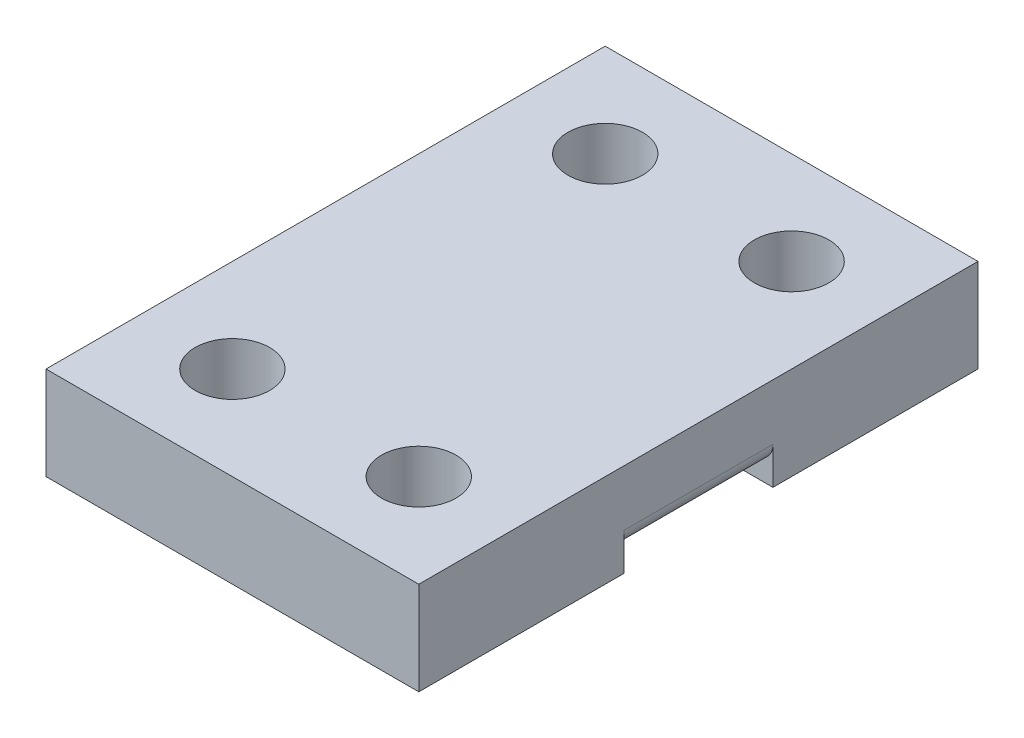
from build123d import *

# Parameters (mm, degrees)
SKETCH_1_W               = 20
SKETCH_1_H               = 30
SKETCH_1_R               = 2
EXTRUDE_1_DEPTH          = 5
CUT_EXTRUDE_6_DEPTH      = 4
CUT_EXTRUDE_6_DEPTH_BACK = 4
CUT_EXTRUDE_6_START      = -15
FILLET_1_R               = 1


with BuildPart() as part:
    # 스케치1 → 보스-돌출1 (new body)
    with BuildSketch(Plane(origin=(0, 0, 0), x_dir=(1, 0, 0), z_dir=(0, 1, 0))):
        with Locations((0, 15)):
            Rectangle(SKETCH_1_W, SKETCH_1_H)
        with Locations(Location((5, 25, 0), (0, 0, 270))):
            Circle(SKETCH_1_R, mode=Mode.SUBTRACT)
        with Locations(Location((-5, 25, 0), (0, 0, 90))):
            Circle(SKETCH_1_R, mode=Mode.SUBTRACT)
        with Locations(Location((5, 5, 0), (0, 0, 270))):
            Circle(SKETCH_1_R, mode=Mode.SUBTRACT)
        with Locations(Location((-5, 5, 0), (0, 0, 90))):
            Circle(SKETCH_1_R, mode=Mode.SUBTRACT)
    extrude(amount=EXTRUDE_1_DEPTH)

    # 스케치3 → 컷-돌출6 (cut, two sides: drawn at the far end of the back side and taken through both)
    with BuildSketch(Plane(origin=(0, 0, -30), x_dir=(-1, 0, 0), z_dir=(0, 0, -1)).offset(CUT_EXTRUDE_6_START - CUT_EXTRUDE_6_DEPTH_BACK)):
        Polygon((0, 0), (-1, 1), (-2, 0), align=None)
        Polygon((1, 1), (0, 0), (2, 0), align=None)
        Polygon((-2, 0), (-3, 1), (-4, 0), align=None)
        Polygon((3, 1), (2, 0), (4, 0), align=None)
        Polygon((-4, 0), (-5, 1), (-6, 0), align=None)
        Polygon((5, 1), (4, 0), (6, 0), align=None)
        Polygon((-6, 0), (-7, 1), (-8, 0), align=None)
        Polygon((7, 1), (6, 0), (8, 0), align=None)
        Polygon((-8, 0), (-9, 1), (-10, 1), (-10, 0), align=None)
        Polygon((9, 1), (8, 0), (10, 0), (10, 1), align=None)
    extrude(amount=CUT_EXTRUDE_6_DEPTH + CUT_EXTRUDE_6_DEPTH_BACK, mode=Mode.SUBTRACT)

    # 필렛1
    fillet_1_edges = [part.edges().sort_by_distance(p)[0] for p in [
        (10, 1, -15),
        (-10, 1, -15),
    ]]
    fillet(fillet_1_edges, radius=FILLET_1_R - 0.0001)  # a hair under: the kernel refuses the full size


solid = part.part
